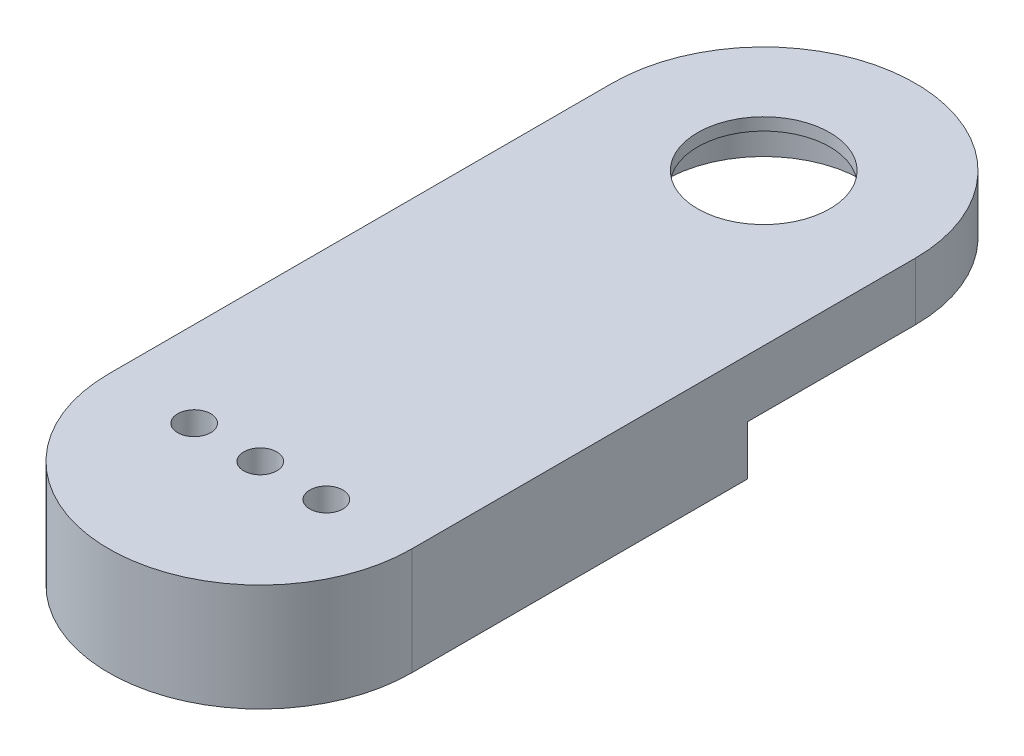
from build123d import *

# Parameters (mm, degrees)
SKETCH1_R           = 12.000000003
SKETCH1_R_2         = 2
BOSS_EXTRUDE1_DEPTH = 13
SKETCH2_R           = 12.000000003
CUT_EXTRUDE1_DEPTH  = 6
BOSS_EXTRUDE2_START = -1.5
SKETCH3_R           = 12.000000003
SKETCH3_R_2         = 8
BOSS_EXTRUDE2_DEPTH = 1.5


with BuildPart() as part:
    # Sketch1 → Boss-Extrude1 (new body)
    with BuildSketch(Plane(origin=(0, 0, 0), x_dir=(1, 0, 0), z_dir=(0, 1, 0))):
        with BuildLine():
            Line((-18.350000003, 0), (-18.350000003, 60.96))
            ThreePointArc((-18.350000003, 60.96), (0, 79.310000003), (18.350000003, 60.96))
            Line((18.350000003, 60.96), (18.350000003, 0))
            ThreePointArc((18.350000003, 0), (0, -18.350000003), (-18.350000003, 0))
        make_face()
        with Locations((0, 60.96)):
            Circle(SKETCH1_R, mode=Mode.SUBTRACT)
        with Locations((-8, 0)):
            Circle(SKETCH1_R_2, mode=Mode.SUBTRACT)
        with Locations((8, 0)):
            Circle(SKETCH1_R_2, mode=Mode.SUBTRACT)
        Circle(SKETCH1_R_2, mode=Mode.SUBTRACT)
    extrude(amount=BOSS_EXTRUDE1_DEPTH)

    # Sketch2 → Cut-Extrude1 (cut)
    with BuildSketch(Plane.XZ):
        with BuildLine():
            Line((-18.350000003, -40.64), (-18.350000003, -60.96))
            ThreePointArc((-18.350000003, -60.96), (0, -79.310000003), (18.350000003, -60.96))
            Line((18.350000003, -60.96), (18.350000003, -40.64))
            Line((18.350000003, -40.64), (-18.350000003, -40.64))
        make_face()
        with Locations((0, -60.96)):
            Circle(SKETCH2_R, mode=Mode.SUBTRACT)
    extrude(amount=-CUT_EXTRUDE1_DEPTH, mode=Mode.SUBTRACT)

    # Sketch3 → Boss-Extrude2 (add)
    with BuildSketch(Plane(origin=(0, 13, 0), x_dir=(1, 0, 0), z_dir=(0, 1, 0)).offset(BOSS_EXTRUDE2_START)):
        with Locations((0, 60.96)):
            Circle(SKETCH3_R)
        with Locations((0, 60.96)):
            Circle(SKETCH3_R_2, mode=Mode.SUBTRACT)
    extrude(amount=BOSS_EXTRUDE2_DEPTH)


solid = part.part
